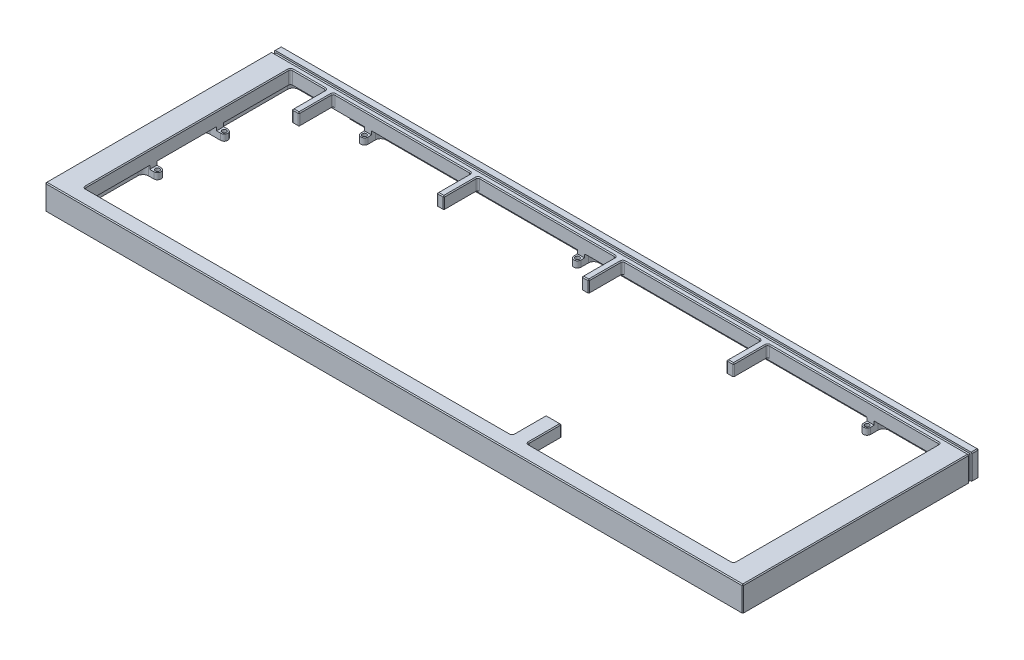
from build123d import *

# Parameters (mm, degrees)
SKETCH1_W                 = 390
SKETCH1_H                 = 132
BOSS_EXTRUDE1_DEPTH       = 14
SKETCH2_W                 = 386
SKETCH2_H                 = 128
CUT_EXTRUDE1_DEPTH        = 1
SKETCH3_W                 = 362.9
SKETCH3_H                 = 115.25
CUT_EXTRUDE2_DEPTH        = 412.970872757
SKETCH4_W                 = 370.3
SKETCH4_H                 = 125.475
CUT_EXTRUDE3_DEPTH        = 5.5
SKETCH5_R                 = 2
SKETCH5_W                 = 6
SKETCH5_H                 = 4
SKETCH5_W_2               = 4
SKETCH5_H_2               = 7.0125
SKETCH5_H_3               = 7.1125
BOSS_EXTRUDE2_DEPTH       = 5.5
SKETCH6_W                 = 362.9
SKETCH6_H                 = 115.25
CUT_EXTRUDE4_DEPTH        = 2
SKETCH7_W                 = 3
SKETCH7_H                 = 33.338
CUT_EXTRUDE5_DEPTH        = 5.5
M2X0_4_TAPPED_HOLE1_D     = 1.6
M2X0_4_TAPPED_HOLE1_DEPTH = 4
M2X0_4_TAPPED_HOLE1_TIP   = 0.480688495
SKETCH10_W                = 12.5
SKETCH10_H                = 1.3
CUT_EXTRUDE6_DEPTH        = 10
SKETCH11_W                = 12.5
SKETCH11_H                = 1
CUT_EXTRUDE7_DEPTH        = 2
M2_CLEARANCE_HOLE1_D      = 2.4
FILLET1_R                 = 3
FILLET2_R                 = 4
SKETCH14_W                = 3.8125
SKETCH14_H                = 19.05
SKETCH14_W_2              = 8.55625
BOSS_EXTRUDE4_DEPTH       = 6.5
FILLET3_R                 = 1
FILLET4_R                 = 0.5
SKETCH15_W                = 390
SKETCH15_H                = 2
CUT_EXTRUDE8_DEPTH        = 1
SKETCH16_W                = 1
SKETCH16_H                = 2
CUT_EXTRUDE9_DEPTH        = 412.938102146
CHAMFER1_SIZE             = 0.5
CHAMFER2_SIZE             = 0.2


# Some blends are built 0.0001 mm under size
with BuildPart() as part:
    # Sketch1 → Boss-Extrude1 (new body)
    with BuildSketch(Plane(origin=(0, 0, 0), x_dir=(1, 0, 0), z_dir=(0, 1, 0))):
        with Locations((195, 66)):
            Rectangle(SKETCH1_W, SKETCH1_H)
    extrude(amount=BOSS_EXTRUDE1_DEPTH)

    # Sketch2 → Cut-Extrude1 (cut)
    with BuildSketch(Plane.XZ):
        with Locations((195, -66)):
            Rectangle(SKETCH2_W, SKETCH2_H)
    extrude(amount=-CUT_EXTRUDE1_DEPTH, mode=Mode.SUBTRACT)

    # Sketch3 → Cut-Extrude2 (cut, through all)
    with BuildSketch(Plane(origin=(0, 14, 0), x_dir=(1, 0, 0), z_dir=(0, 1, 0))):
        with Locations((195, 66)):
            Rectangle(SKETCH3_W, SKETCH3_H)
    extrude(amount=-CUT_EXTRUDE2_DEPTH, mode=Mode.SUBTRACT)

    # Sketch4 → Cut-Extrude3 (cut)
    with BuildSketch(Plane(origin=(0, 1, 0), x_dir=(-1, 0, 0), z_dir=(0, -1, 0))):
        with Locations((-195, 66)):
            Rectangle(SKETCH4_W, SKETCH4_H)
    extrude(amount=-CUT_EXTRUDE3_DEPTH, mode=Mode.SUBTRACT)

    # Sketch5 → Boss-Extrude2 (add)
    with BuildSketch(Plane.XZ.offset(-6.5)):
        with Locations((374.15, -46.95)):
            Circle(SKETCH5_R)
        with Locations((374.15, -84.288)):
            Circle(SKETCH5_R)
        with Locations((337.875, -121.625)):
            Circle(SKETCH5_R)
        with Locations((299.775, -10.275)):
            Circle(SKETCH5_R)
        with Locations((85.4625, -10.275)):
            Circle(SKETCH5_R)
        with Locations((15.85, -46.95)):
            Circle(SKETCH5_R)
        with Locations((175.95, -121.625)):
            Circle(SKETCH5_R)
        with Locations((56.8875, -121.625)):
            Circle(SKETCH5_R)
        with Locations((15.85, -84.288)):
            Circle(SKETCH5_R)
        with Locations((377.15, -46.95)):
            Rectangle(SKETCH5_W, SKETCH5_H)
        with Locations((299.775, -6.76875)):
            Rectangle(SKETCH5_W_2, SKETCH5_H_2)
        with Locations((85.4625, -6.76875)):
            Rectangle(SKETCH5_W_2, SKETCH5_H_2)
        with Locations((12.85, -46.95)):
            Rectangle(SKETCH5_W, SKETCH5_H)
        with Locations((12.85, -84.288)):
            Rectangle(SKETCH5_W, SKETCH5_H)
        with Locations((56.8875, -125.18125)):
            Rectangle(SKETCH5_W_2, SKETCH5_H_3)
        with Locations((175.95, -125.18125)):
            Rectangle(SKETCH5_W_2, SKETCH5_H_3)
        with Locations((337.875, -125.18125)):
            Rectangle(SKETCH5_W_2, SKETCH5_H_3)
        with Locations((377.15, -84.288)):
            Rectangle(SKETCH5_W, SKETCH5_H)
    extrude(amount=BOSS_EXTRUDE2_DEPTH)

    # Sketch6 → Cut-Extrude4 (cut)
    with BuildSketch(Plane(origin=(0, 6.5, 0), x_dir=(1, 0, 0), z_dir=(0, 1, 0))):
        with Locations((195, 66)):
            Rectangle(SKETCH6_W, SKETCH6_H)
    extrude(amount=-CUT_EXTRUDE4_DEPTH, mode=Mode.SUBTRACT)

    # Sketch7 → Cut-Extrude5 (cut)
    with BuildSketch(Plane(origin=(0, 1, 0), x_dir=(-1, 0, 0), z_dir=(0, -1, 0))):
        with Locations((-381.65, 65.619)):
            Rectangle(SKETCH7_W, SKETCH7_H)
        with Locations((-8.35, 65.619)):
            Rectangle(SKETCH7_W, SKETCH7_H)
    extrude(amount=-CUT_EXTRUDE5_DEPTH, mode=Mode.SUBTRACT)

    # M2x0.4 Tapped Hole1
    with Locations(Plane(origin=(359.7125, 6.5, -126.5375), x_dir=(0, 0, -1), z_dir=(0, -1, 0))):
        with Locations((0, 0), (-60.9185, 21.2375), (-121.075, -19.05), (-121.075, -147.3375), (0, -102.8), (0, -243.29375), (0, -333.8625), (-60.9185, -350.6625), (-121.075, -312.75625)):
            Hole(M2X0_4_TAPPED_HOLE1_D / 2, depth=M2X0_4_TAPPED_HOLE1_DEPTH)
            with Locations((0, 0, -(M2X0_4_TAPPED_HOLE1_DEPTH + M2X0_4_TAPPED_HOLE1_TIP / 2))):  # 118° drill point
                Cone(0, M2X0_4_TAPPED_HOLE1_D / 2, M2X0_4_TAPPED_HOLE1_TIP, mode=Mode.SUBTRACT)

    # Sketch10 → Cut-Extrude6 (cut)
    with BuildSketch(Plane(origin=(0, 0, -132), x_dir=(-1, 0, 0), z_dir=(0, 0, -1))):
        with Locations((-35.45625, 0.65)):
            Rectangle(SKETCH10_W, SKETCH10_H)
    extrude(amount=-CUT_EXTRUDE6_DEPTH, mode=Mode.SUBTRACT)

    # Sketch11 → Cut-Extrude7 (cut)
    with BuildSketch(Plane.XZ.offset(-1.3)):
        with Locations((35.45625, -129.2375)):
            Rectangle(SKETCH11_W, SKETCH11_H)
    extrude(amount=-CUT_EXTRUDE7_DEPTH, mode=Mode.SUBTRACT)

    # M2 Clearance Hole1 (through all)
    with Locations(Plane(origin=(15.85, 4.5, -46.95), x_dir=(0, 0, 1), z_dir=(0, 1, 0))):
        with Locations((0, 0), (-37.338, 0), (-74.675, 41.0375), (36.675, 69.6125), (-74.675, 160.1), (36.675, 283.925), (0, 358.3), (-37.338, 358.3), (-74.675, 322.025)):
            Hole(M2_CLEARANCE_HOLE1_D / 2)

    # Fillet1
    # the kernel refuses this fillet: 3 mm, written as the material it adds along each edge
    with BuildSketch(Plane(origin=(380.15, 1, -3.2625), x_dir=(-1, 0, 0), z_dir=(0, 1, 0)), Plane(origin=(9.85, 1, -3.2625), x_dir=(0, 0, -1), z_dir=(0, 1, 0)), Plane(origin=(177.95, 14, -128.7375), x_dir=(0, 0, 1), z_dir=(0, -1, 0)), Plane(origin=(54.8875, 14, -128.7375), x_dir=(-1, 0, 0), z_dir=(0, -1, 0)), Plane(origin=(58.8875, 14, -128.7375), x_dir=(0, 0, 1), z_dir=(0, -1, 0)), Plane(origin=(9.85, 1, -128.7375), x_dir=(1, 0, 0), z_dir=(0, 1, 0)), Plane(origin=(9.85, 14, -86.288), x_dir=(1, 0, 0), z_dir=(0, -1, 0)), Plane(origin=(6.85, 1, -82.288), x_dir=(1, 0, 0), z_dir=(0, 1, 0)), Plane(origin=(83.4625, 14, -3.2625), x_dir=(0, 0, -1), z_dir=(0, -1, 0)), Plane(origin=(297.775, 14, -3.2625), x_dir=(0, 0, -1), z_dir=(0, -1, 0)), Plane(origin=(380.15, 14, -44.95), x_dir=(-1, 0, 0), z_dir=(0, -1, 0)), Plane(origin=(383.15, 1, -48.95), x_dir=(-1, 0, 0), z_dir=(0, 1, 0)), Plane(origin=(339.875, 14, -128.7375), x_dir=(0, 0, 1), z_dir=(0, -1, 0))) as fillet1_piece_1:
        with BuildLine():
            CenterArc((FILLET1_R, -FILLET1_R), FILLET1_R, 90, 90)
            Line((0, -FILLET1_R), (-FILLET1_R * 0.02, -FILLET1_R))
            Line((-FILLET1_R * 0.02, -FILLET1_R), (-FILLET1_R * 0.02, FILLET1_R * 0.02))
            Line((-FILLET1_R * 0.02, FILLET1_R * 0.02), (FILLET1_R, FILLET1_R * 0.02))
            Line((FILLET1_R, FILLET1_R * 0.02), (FILLET1_R, 0))
        make_face()
    extrude(amount=13)
    with BuildSketch(Plane(origin=(29.20625, 1.3, -129.7375), x_dir=(0, 0, 1), z_dir=(0, 1, 0))) as fillet1_piece_2:
        with BuildLine():
            CenterArc((3, 2.236067977), FILLET1_R, 180, 48.189685104)
            Line((0, 2.236067977), (-0.06, 2.236067977))
            Line((-0.06, 2.236067977), (-0.06, 0))
            Line((-0.06, 0), (0, -0.06))
            ThreePointArc((0, -0.06), (0.5, -0.06), (0.96, -0.04472136))
            Line((0.96, -0.04472136), (1, 0))
        make_face()
    extrude(amount=7.590169944)
    with BuildSketch(Plane(origin=(41.70625, 1.3, -129.7375), x_dir=(0, 0, 1), z_dir=(0, 1, 0))) as fillet1_piece_3:
        with BuildLine():
            CenterArc((3, -2.236067977), FILLET1_R, 131.810314896, 48.189685104)
            Line((0, -2.236067977), (-0.06, -2.236067977))
            Line((-0.06, -2.236067977), (-0.06, 0))
            Line((-0.06, 0), (0, 0.06))
            ThreePointArc((0, 0.06), (0.5, 0.06), (0.96, 0.04472136))
            Line((0.96, 0.04472136), (1, 0))
        make_face()
    extrude(amount=7.590169944)
    with BuildSketch(Plane(origin=(173.95, 14, -128.7375), x_dir=(0, 0, 1), z_dir=(0, -1, 0)), Plane(origin=(6.85, 1, -48.95), x_dir=(1, 0, 0), z_dir=(0, 1, 0)), Plane(origin=(9.85, 14, -44.95), x_dir=(1, 0, 0), z_dir=(0, -1, 0)), Plane(origin=(87.4625, 14, -3.2625), x_dir=(0, 0, -1), z_dir=(0, -1, 0)), Plane(origin=(301.775, 14, -3.2625), x_dir=(0, 0, -1), z_dir=(0, -1, 0)), Plane(origin=(380.15, 14, -86.288), x_dir=(-1, 0, 0), z_dir=(0, -1, 0)), Plane(origin=(383.15, 1, -82.288), x_dir=(-1, 0, 0), z_dir=(0, 1, 0)), Plane(origin=(380.15, 1, -128.7375), x_dir=(-1, 0, 0), z_dir=(0, 1, 0)), Plane(origin=(335.875, 14, -128.7375), x_dir=(0, 0, 1), z_dir=(0, -1, 0))) as fillet1_piece_4:
        with BuildLine():
            CenterArc((FILLET1_R, FILLET1_R), FILLET1_R, 180, 90)
            Line((0, FILLET1_R), (-FILLET1_R * 0.02, FILLET1_R))
            Line((-FILLET1_R * 0.02, FILLET1_R), (-FILLET1_R * 0.02, -FILLET1_R * 0.02))
            Line((-FILLET1_R * 0.02, -FILLET1_R * 0.02), (FILLET1_R, -FILLET1_R * 0.02))
            Line((FILLET1_R, -FILLET1_R * 0.02), (FILLET1_R, 0))
        make_face()
    extrude(amount=13)

    # Fillet2
    fillet2_edges = [part.edges().sort_by_distance(p)[0] for p in [
        (388, 0.5, -2),
        (388, 0.5, -130),
        (2, 0.5, -130),
        (2, 0.5, -2),
    ]]
    fillet(fillet2_edges, radius=FILLET2_R)

    # Sketch14 → Boss-Extrude4 (add)
    with BuildSketch(Plane(origin=(0, 14, 0), x_dir=(1, 0, 0), z_dir=(0, 1, 0))):
        with Locations((35.45625, 114.1)):
            Rectangle(SKETCH14_W, SKETCH14_H)
        with Locations((116.41875, 114.1)):
            Rectangle(SKETCH14_W, SKETCH14_H)
        with Locations((278.34375, 114.1)):
            Rectangle(SKETCH14_W, SKETCH14_H)
        with Locations((256.921875, 17.9)):
            Rectangle(SKETCH14_W_2, SKETCH14_H)
        with Locations((197.38125, 114.1)):
            Rectangle(SKETCH14_W, SKETCH14_H)
    extrude(amount=-BOSS_EXTRUDE4_DEPTH)

    # Fillet3
    fillet3_edges = [part.edges().sort_by_distance(p)[0] for p in [
        (13.55, 10.25, -8.375),
        (376.45, 10.25, -8.375),
        (376.45, 10.25, -123.625),
        (13.55, 10.25, -123.625),
        (37.3625, 10.75, -123.625),
        (33.55, 10.75, -123.625),
        (118.325, 10.75, -123.625),
        (114.5125, 10.75, -123.625),
        (199.2875, 10.75, -123.625),
        (195.475, 10.75, -123.625),
        (280.25, 10.75, -123.625),
        (276.4375, 10.75, -123.625),
        (261.2, 10.75, -8.375),
        (252.64375, 10.75, -8.375),
    ]]
    fillet(fillet3_edges, radius=FILLET3_R)

    # Fillet4
    fillet4_edges = [part.edges().sort_by_distance(p)[0] for p in [
        (37.3625, 10.75, -104.575),
        (33.55, 10.75, -104.575),
        (118.325, 10.75, -104.575),
        (114.5125, 10.75, -104.575),
        (199.2875, 10.75, -104.575),
        (195.475, 10.75, -104.575),
        (280.25, 10.75, -104.575),
        (276.4375, 10.75, -104.575),
        (261.2, 10.75, -27.425),
        (252.64375, 10.75, -27.425),
    ]]
    fillet(fillet4_edges, radius=FILLET4_R)

    # Sketch15 → Cut-Extrude8 (cut)
    with BuildSketch(Plane(origin=(0, 14, 0), x_dir=(1, 0, 0), z_dir=(0, 1, 0))):
        with Locations((195, 127.125)):
            Rectangle(SKETCH15_W, SKETCH15_H)
    extrude(amount=-CUT_EXTRUDE8_DEPTH, mode=Mode.SUBTRACT)

    # Sketch16 → Cut-Extrude9 (cut, through all)
    with BuildSketch(Plane(origin=(0, 13, 0), x_dir=(1, 0, 0), z_dir=(0, 1, 0))):
        with Locations((0.5, 127.125)):
            Rectangle(SKETCH16_W, SKETCH16_H)
        with Locations((389.5, 127.125)):
            Rectangle(SKETCH16_W, SKETCH16_H)
    extrude(amount=-CUT_EXTRUDE9_DEPTH, mode=Mode.SUBTRACT)

    # Chamfer1
    chamfer1_edges = [part.edges().sort_by_distance(p)[0] for p in [
        (0, 14, -63.0625),
        (390, 14, -130.0625),
        (390, 14, -63.0625),
        (177.95, 6.5, -124.68125),
        (195, 14, -132),
        (0, 14, -130.0625),
        (256.9125, 6.5, -128.7375),
        (334.996320344, 6.5, -127.858820344),
        (178.828679656, 6.5, -127.858820344),
        (0, 7, -132),
        (390, 7, -132),
        (390, 7, 0),
        (0, 7, 0),
        (133.096875, 14, -8.375),
        (261.2, 14, -18.15),
        (328.35, 14, -123.625),
        (276.4375, 14, -113.85),
        (195.475, 14, -113.85),
        (114.5125, 14, -113.85),
        (33.55, 14, -113.85),
        (376.45, 14, -66),
        (13.55, 14, -66),
        (261.492893219, 14, -8.667893219),
        (252.350856781, 14, -8.667893219),
        (276.144606781, 14, -123.332106781),
        (280.542893219, 14, -123.332106781),
        (199.580393219, 14, -123.332106781),
        (195.182106781, 14, -123.332106781),
        (118.617893219, 14, -123.332106781),
        (114.219606781, 14, -123.332106781),
        (37.655393219, 14, -123.332106781),
        (33.257106781, 14, -123.332106781),
        (376.157106781, 14, -123.332106781),
        (376.157106781, 14, -8.667893219),
        (13.842893219, 14, -8.667893219),
        (335.875, 6.5, -124.68125),
        (13.842893219, 14, -123.332106781),
        (195, 14, 0),
        (256.921875, 14, -27.425),
        (35.45625, 14, -104.575),
        (37.3625, 14, -113.85),
        (116.41875, 14, -104.575),
        (118.325, 14, -113.85),
        (197.38125, 14, -104.575),
        (199.2875, 14, -113.85),
        (278.34375, 14, -104.575),
        (280.25, 14, -113.85),
        (252.64375, 14, -18.15),
    ]]
    chamfer(chamfer1_edges, length=CHAMFER1_SIZE - 0.0001)  # a hair under: the kernel refuses the full size

    # Chamfer2
    chamfer2_edges = [part.edges().sort_by_distance(p)[0] for p in [
        (390, 0, -129.81255),
        (0, 0, -63.31245),
        (390, 0, -63.31245),
        (0, 0, -129.81255),
        (215.603175, 0, -132),
        (195, 0, 0),
        (0.24995, 0, -131.75005),
        (389.75005, 0, -131.75005),
        (0.24995, 0, -0.24995),
        (389.75005, 0, -0.24995),
        (14.853075, 0, -132),
    ]]
    chamfer(chamfer2_edges, length=CHAMFER2_SIZE)


solid = part.part
